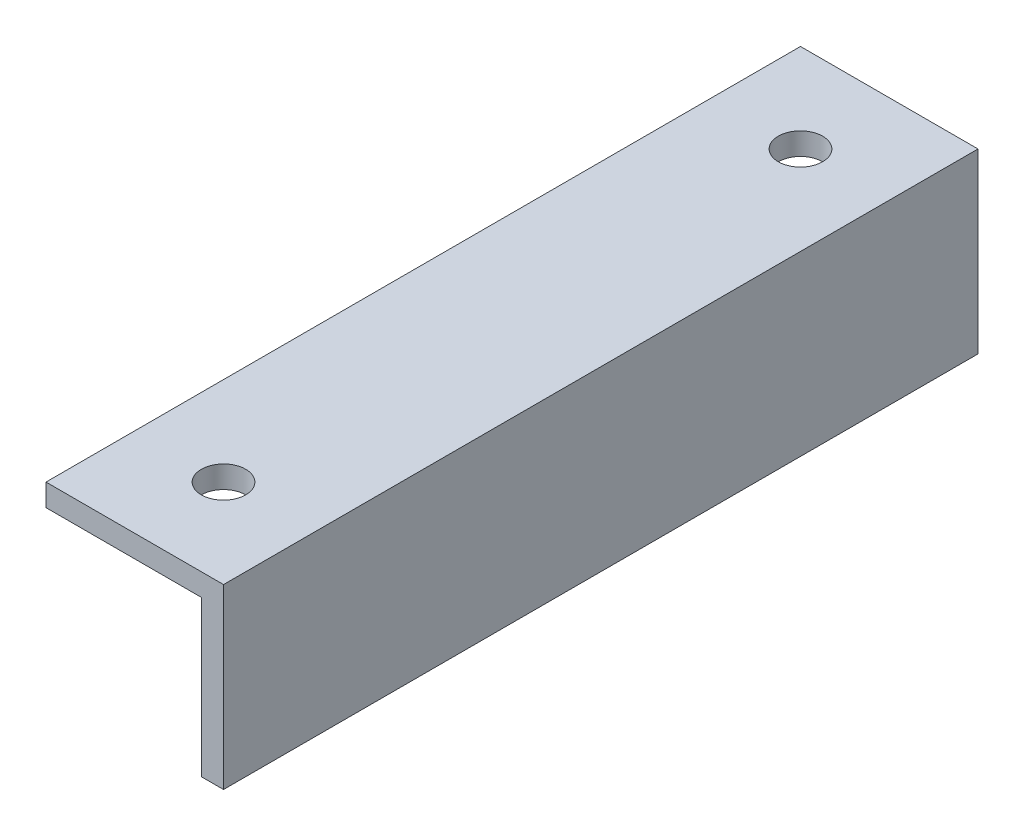
from build123d import *

# Parameters (mm, degrees)
BOSS_EXTRUDE1_DEPTH = 107.95
CUT_EXTRUDE1_REACH  = 115.103
SKETCH2_R           = 3.175


with BuildPart() as part:
    # Sketch1 → Boss-Extrude1 (new body)
    with BuildSketch(Plane.XY):
        Polygon((0, 0), (25.4, 0), (25.4, -25.4), (22.225, -25.4), (22.225, -3.175), (0, -3.175), align=None)
    extrude(amount=BOSS_EXTRUDE1_DEPTH)

    # Sketch2 → Cut-Extrude1 (cut, up to next)
    with BuildSketch(Plane.XZ.offset(3.175), mode=Mode.PRIVATE) as cut_extrude1_sk1:
        with Locations((12.7, 12.7)):
            Circle(SKETCH2_R)
    cut_extrude1_tool1 = extrude(cut_extrude1_sk1.sketch, amount=-CUT_EXTRUDE1_REACH, mode=Mode.PRIVATE) & part.part
    # Sketch2 → Cut-Extrude1 (cut, up to next)
    with BuildSketch(Plane.XZ.offset(3.175), mode=Mode.PRIVATE) as cut_extrude1_sk2:
        with Locations((12.7, 95.25)):
            Circle(SKETCH2_R)
    cut_extrude1_tool2 = extrude(cut_extrude1_sk2.sketch, amount=-CUT_EXTRUDE1_REACH, mode=Mode.PRIVATE) & part.part
    add(cut_extrude1_tool1.solids().sort_by_distance((12.7, -3.175, 12.7))[0], mode=Mode.SUBTRACT)
    add(cut_extrude1_tool2.solids().sort_by_distance((12.7, -3.175, 95.25))[0], mode=Mode.SUBTRACT)


solid = part.part
